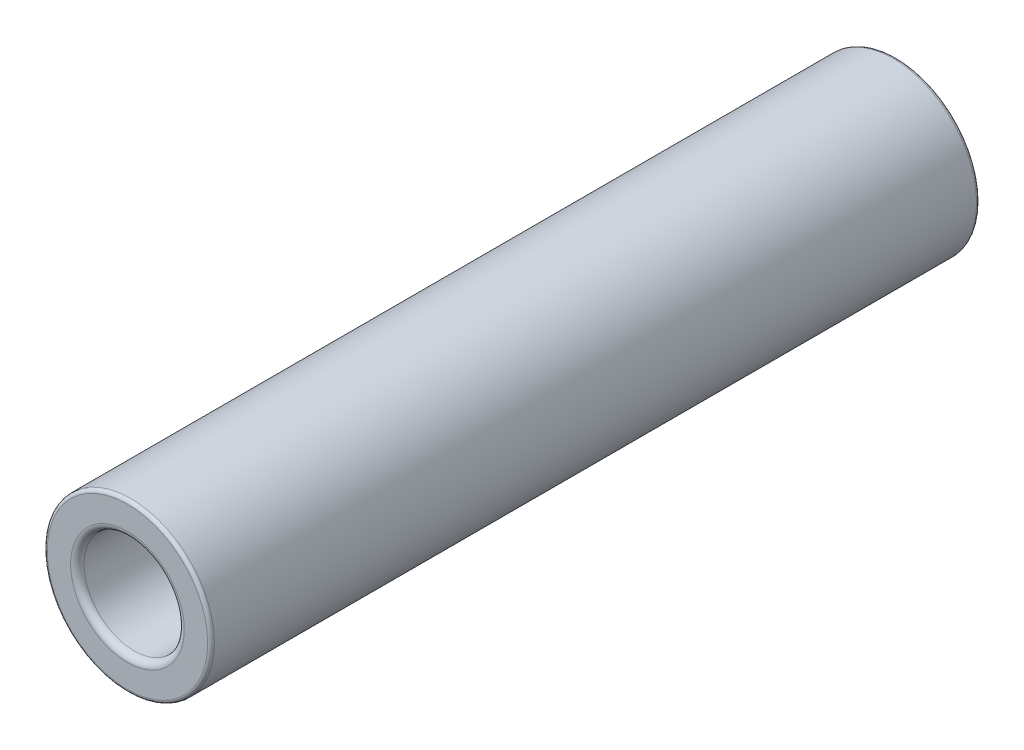
from build123d import *

# Parameters (mm, degrees)
CROQUIS1_R              = 2.5
CROQUIS1_R_2            = 1.5
SALIENTE_EXTRUIR2_DEPTH = 23
REDONDEO5_R             = 0.1
REDONDEO6_R             = 0.2


with BuildPart() as part:
    # Croquis1 → Saliente-Extruir2 (new body)
    with BuildSketch(Plane.XY):
        Circle(CROQUIS1_R)
        Circle(CROQUIS1_R_2, mode=Mode.SUBTRACT)
    extrude(amount=SALIENTE_EXTRUIR2_DEPTH)

    # Redondeo5
    redondeo5_edges = [part.edges().sort_by_distance(p)[0] for p in [
        (-2.5, 0, 0),
        (-2.5, 0, 23),
    ]]
    fillet(redondeo5_edges, radius=REDONDEO5_R)

    # Redondeo6
    redondeo6_edges = [part.edges().sort_by_distance(p)[0] for p in [
        (-1.5, 0, 0),
        (-1.5, 0, 23),
    ]]
    fillet(redondeo6_edges, radius=REDONDEO6_R)


solid = part.part
